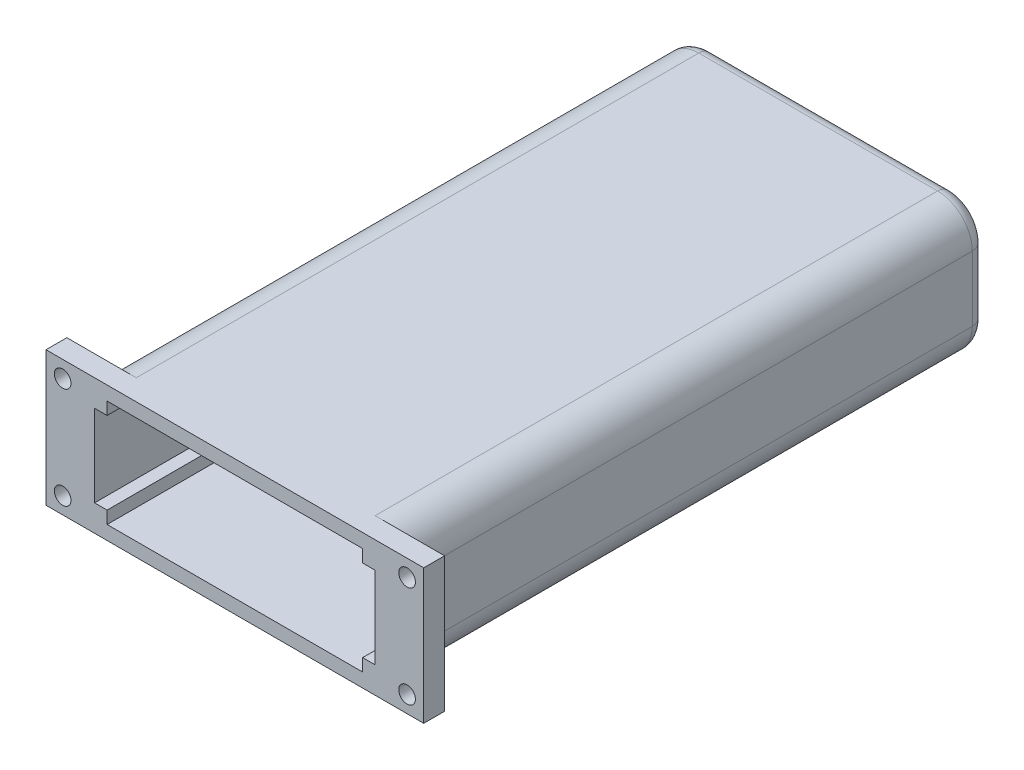
from build123d import *

# Parameters (mm, degrees)
SKETCH_1_W      = 44.4
SKETCH_1_H      = 19.4
EXTRUDE_1_DEPTH = 83
FILLET_6_R      = 5
FILLET_7_R      = 5
FILLET_8_R      = 5
FILLET_9_R      = 5
FILLET_11_R     = 2
EXTRUDE_2_DEPTH = 3
EXTRUDE_START   = 3
SKETCH_3_R      = 1.2
EXTRUDE_3_DEPTH = 3


with BuildPart() as part:
    # 草图1 → 凸台-拉伸1 (new body)
    with BuildSketch(Plane.XY):
        with Locations((11.2, 0.3)):
            Rectangle(SKETCH_1_W, SKETCH_1_H)
        Polygon((-9, 6.2), (-9, -5.6), (-7.2, -5.6), (-7.2, -7.4), (29.6, -7.4), (29.6, -5.6), (31.4, -5.6), (31.4, 6.2), (29.6, 6.2), (29.6, 8), (-7.2, 8), (-7.2, 6.2), align=None, mode=Mode.SUBTRACT)
    extrude(amount=EXTRUDE_1_DEPTH)

    # 圆角6
    fillet_6_edges = [part.edges().sort_by_distance(p)[0] for p in [
        (-11, -9.4, 41.5),
    ]]
    fillet(fillet_6_edges, radius=FILLET_6_R)

    # 圆角7
    fillet_7_edges = [part.edges().sort_by_distance(p)[0] for p in [
        (-11, 10, 41.5),
    ]]
    fillet(fillet_7_edges, radius=FILLET_7_R)

    # 圆角8
    fillet_8_edges = [part.edges().sort_by_distance(p)[0] for p in [
        (33.4, 10, 41.5),
    ]]
    fillet(fillet_8_edges, radius=FILLET_8_R)

    # 圆角9
    fillet_9_edges = [part.edges().sort_by_distance(p)[0] for p in [
        (33.4, -9.4, 41.5),
    ]]
    fillet(fillet_9_edges, radius=FILLET_9_R)

    # 圆角11
    # the kernel refuses this fillet: 2 mm, written as the material it takes off along each edge
    with BuildSketch(Plane(origin=(28.4, -9.4, 0), x_dir=(0, 1, 0), z_dir=(-1, 0, 0)), Plane(origin=(-6, 10, 0), x_dir=(0, -1, 0), z_dir=(1, 0, 0))) as fillet_11_piece_1:
        with BuildLine():
            CenterArc((FILLET_11_R, -FILLET_11_R), FILLET_11_R, 90, 90)
            Line((0, -FILLET_11_R), (0, 0))
            Line((0, 0), (FILLET_11_R, 0))
        make_face()
    extrude(amount=34.4, mode=Mode.SUBTRACT)
    with BuildSketch(Plane(origin=(-6, -4.4, 0), x_dir=(0, -1, 0), z_dir=(1, 0, 0))) as fillet_11_piece_2:
        with BuildLine():
            CenterArc((5 - FILLET_11_R, -FILLET_11_R), FILLET_11_R, 0, 90)
            Line((5, -FILLET_11_R), (5, 0))
            Line((5, 0), (5 - FILLET_11_R, 0))
        make_face()
    revolve(axis=Axis((-6, -4.4, 0), (0, 0, -1)), revolution_arc=90, mode=Mode.SUBTRACT)
    with BuildSketch(Plane(origin=(-11, -4.4, 0), x_dir=(1, 0, 0), z_dir=(0, 1, 0)), Plane(origin=(33.4, 5, 0), x_dir=(-1, 0, 0), z_dir=(0, -1, 0))) as fillet_11_piece_3:
        with BuildLine():
            CenterArc((FILLET_11_R, -FILLET_11_R), FILLET_11_R, 90, 90)
            Line((0, -FILLET_11_R), (0, 0))
            Line((0, 0), (FILLET_11_R, 0))
        make_face()
    extrude(amount=9.4, mode=Mode.SUBTRACT)
    with BuildSketch(Plane(origin=(-6, 5, 0), x_dir=(-1, 0, 0), z_dir=(0, -1, 0))) as fillet_11_piece_4:
        with BuildLine():
            CenterArc((5 - FILLET_11_R, -FILLET_11_R), FILLET_11_R, 0, 90)
            Line((5, -FILLET_11_R), (5, 0))
            Line((5, 0), (5 - FILLET_11_R, 0))
        make_face()
    revolve(axis=Axis((-6, 5, 0), (0, 0, -1)), revolution_arc=90, mode=Mode.SUBTRACT)
    with BuildSketch(Plane(origin=(28.4, 5, 0), x_dir=(0, 1, 0), z_dir=(-1, 0, 0))) as fillet_11_piece_5:
        with BuildLine():
            CenterArc((5 - FILLET_11_R, -FILLET_11_R), FILLET_11_R, 0, 90)
            Line((5, -FILLET_11_R), (5, 0))
            Line((5, 0), (5 - FILLET_11_R, 0))
        make_face()
    revolve(axis=Axis((28.4, 5, 0), (0, 0, -1)), revolution_arc=90, mode=Mode.SUBTRACT)
    with BuildSketch(Plane(origin=(28.4, -4.4, 0), x_dir=(1, 0, 0), z_dir=(0, 1, 0))) as fillet_11_piece_6:
        with BuildLine():
            CenterArc((5 - FILLET_11_R, -FILLET_11_R), FILLET_11_R, 0, 90)
            Line((5, -FILLET_11_R), (5, 0))
            Line((5, 0), (5 - FILLET_11_R, 0))
        make_face()
    revolve(axis=Axis((28.4, -4.4, 0), (0, 0, -1)), revolution_arc=90, mode=Mode.SUBTRACT)

    # 草图2 → 凸台-拉伸2 (add)
    with BuildSketch(Plane(origin=(0, 0, 0), x_dir=(-1, 0, 0), z_dir=(0, 0, -1))):
        Polygon((-31.4, 6.2), (-31.4, -5.6), (-29.6, -5.6), (-29.6, -7.4), (7.2, -7.4), (7.2, -5.6), (9, -5.6), (9, 6.2), (7.2, 6.2), (7.2, 8), (-29.6, 8), (-29.6, 6.2), align=None)
    extrude(amount=-EXTRUDE_2_DEPTH)

    # 草图3 → 凸台-拉伸3 (add)
    # profile 1 of 3: a face of its own
    with BuildSketch(Plane.XY.offset(83).offset(EXTRUDE_START)):
        with BuildLine():
            Line((-6, 10), (-16, 10))
            Line((-16, 10), (-16, -9.4))
            Line((-16, -9.4), (-6, -9.4))
            ThreePointArc((-6, -9.4), (-9.535533906, -7.935533906), (-11, -4.4))
            Line((-11, -4.4), (-11, 5))
            ThreePointArc((-11, 5), (-9.535533906, 8.535533906), (-6, 10))
        make_face()
        with Locations((-13.6, -7)):
            Circle(SKETCH_3_R, mode=Mode.SUBTRACT)
        with Locations((-13.6, 7.6)):
            Circle(SKETCH_3_R, mode=Mode.SUBTRACT)
    # profile 2 of 3: a face of its own
    with BuildSketch(Plane.XY.offset(83).offset(EXTRUDE_START)):
        with BuildLine():
            Line((38.4, 10), (28.4, 10))
            ThreePointArc((28.4, 10), (31.935533906, 8.535533906), (33.4, 5))
            Line((33.4, 5), (33.4, -4.4))
            ThreePointArc((33.4, -4.4), (31.935533906, -7.935533906), (28.4, -9.4))
            Line((28.4, -9.4), (38.4, -9.4))
            Line((38.4, -9.4), (38.4, 10))
        make_face()
        with Locations((36, -7)):
            Circle(SKETCH_3_R, mode=Mode.SUBTRACT)
        with Locations((36, 7.6)):
            Circle(SKETCH_3_R, mode=Mode.SUBTRACT)
    # profile 3 of 3: a face of its own
    with BuildSketch(Plane.XY.offset(83).offset(EXTRUDE_START)):
        with BuildLine():
            ThreePointArc((-11, -4.4), (-9.535533906, -7.935533906), (-6, -9.4))
            Line((-6, -9.4), (28.4, -9.4))
            ThreePointArc((28.4, -9.4), (31.935533906, -7.935533906), (33.4, -4.4))
            Line((33.4, -4.4), (33.4, 5))
            ThreePointArc((33.4, 5), (31.935533906, 8.535533906), (28.4, 10))
            Line((28.4, 10), (-6, 10))
            ThreePointArc((-6, 10), (-9.535533906, 8.535533906), (-11, 5))
            Line((-11, 5), (-11, -4.4))
        make_face()
        Polygon((-7.2, -5.6), (-9, -5.6), (-9, 6.2), (-7.2, 6.2), (-7.2, 8), (29.6, 8), (29.6, 6.2), (31.4, 6.2), (31.4, -5.6), (29.6, -5.6), (29.6, -7.4), (-7.2, -7.4), align=None, mode=Mode.SUBTRACT)
    extrude(amount=-EXTRUDE_3_DEPTH)


solid = part.part
